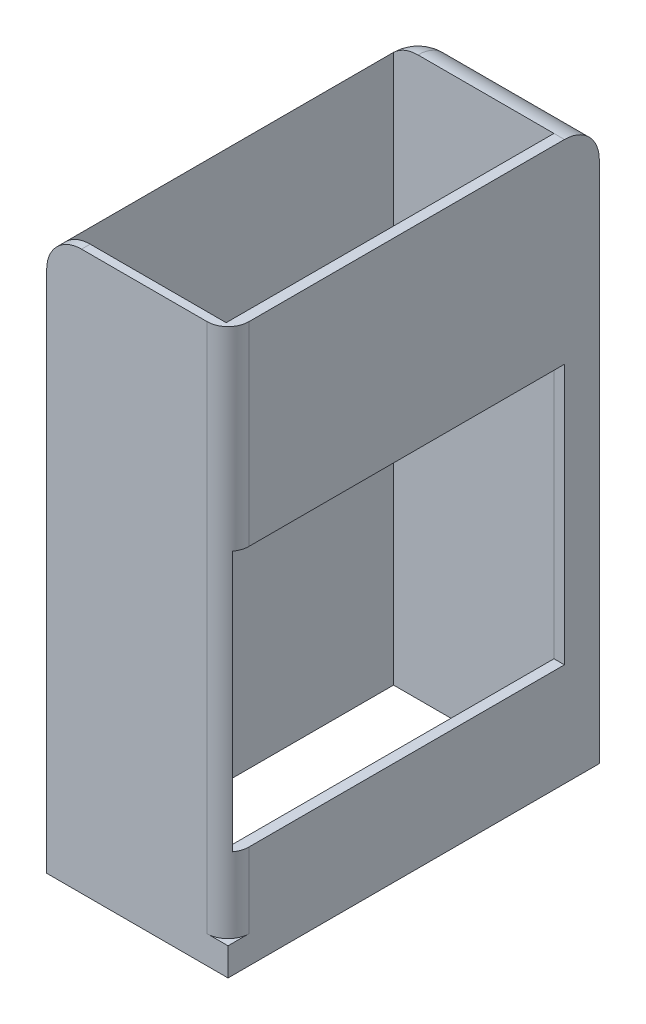
from build123d import *

# Parameters (mm, degrees)
BOSS_EXTRUDE1_DEPTH = 4
BOSS_EXTRUDE2_DEPTH = 80
SKETCH3_R           = 8.5
CUT_EXTRUDE1_DEPTH  = 171
SKETCH4_W           = 68
SKETCH4_H           = 18.002499925
CUT_EXTRUDE2_DEPTH  = 116
SKETCH5_W           = 23
SKETCH5_H           = 47
CUT_EXTRUDE3_DEPTH  = 110.266506281
SKETCH8_W           = 47
SKETCH8_H           = 37.321718457
CUT_EXTRUDE6_DEPTH  = 3.266506281
FILLET2_R           = 5
FILLET3_R           = 5
FILLET4_R           = 5
SKETCH9_W           = 106
SKETCH9_H           = 50.845410363
CUT_EXTRUDE7_DEPTH  = 92
FILLET16_R          = 10
FILLET18_R          = 3
CUT_EXTRUDE9_DEPTH  = 90


with BuildPart() as part:
    # Sketch1 → Boss-Extrude1 (new body)
    with BuildSketch(Plane(origin=(0, 0, 0), x_dir=(1, 0, 0), z_dir=(0, 1, 0))):
        Polygon((0, 152), (0, 101.37), (75, 101.37), (75, 191.351980657), (75, 192.37), (0, 192.37), align=None)
    extrude(amount=BOSS_EXTRUDE1_DEPTH)

    # Sketch2 → Boss-Extrude2 (add)
    with BuildSketch(Plane(origin=(0, 0, 0), x_dir=(-1, 0, 0), z_dir=(0, -1, 0))):
        Polygon((26, 91.37), (26, 176.99818396), (26, 195.45), (-80, 195.45), (-80, 176.99818396), (-80, 91.37), align=None)
        Polygon((-75, 192), (-75, 192.37), (0, 192.37), (0, 101.37), (-75, 101.37), align=None, mode=Mode.SUBTRACT)
    extrude(amount=-BOSS_EXTRUDE2_DEPTH)

    # Sketch3 → Cut-Extrude1 (cut)
    with BuildSketch(Plane.XY.offset(18)):
        with Locations((34.765402097, 21.5)):
            Circle(SKETCH3_R)
    extrude(amount=-CUT_EXTRUDE1_DEPTH, mode=Mode.SUBTRACT)

    # Sketch4 → Cut-Extrude2 (cut)
    with BuildSketch(Plane(origin=(0, 4, 0), x_dir=(1, 0, 0), z_dir=(0, 1, 0))):
        with Locations((34.5, 183.368750038)):
            Rectangle(SKETCH4_W, SKETCH4_H)
    extrude(amount=-CUT_EXTRUDE2_DEPTH, mode=Mode.SUBTRACT)

    # Sketch5 → Cut-Extrude3 (cut)
    with BuildSketch(Plane(origin=(0, 80, 0), x_dir=(1, 0, 0), z_dir=(0, 1, 0))):
        with Locations((-13, 166.95)):
            Rectangle(SKETCH5_W, SKETCH5_H)
    extrude(amount=-CUT_EXTRUDE3_DEPTH, mode=Mode.SUBTRACT)

    # Sketch8 → Cut-Extrude6 (cut)
    with BuildSketch(Plane.ZY.offset(1.5)):
        with Locations((-166.95181604, 33.429515658)):
            Rectangle(SKETCH8_W, SKETCH8_H)
    extrude(amount=-CUT_EXTRUDE6_DEPTH, mode=Mode.SUBTRACT)

    # Fillet2
    # the kernel refuses this fillet: 5 mm, written as the material it takes off along each edge
    with BuildSketch(Plane(origin=(-21, 75, -190.45), x_dir=(0, 0, -1), z_dir=(0, 1, 0))) as fillet2_piece_1_section:
        Polygon((0, 0), (FILLET2_R, 0), (FILLET2_R, FILLET2_R), (0, FILLET2_R), align=None)
    fillet2_piece_1 = extrude(amount=FILLET2_R, mode=Mode.PRIVATE)
    fillet2_piece_1 = fillet2_piece_1 - Plane(origin=(-21, 75, -190.45), x_dir=(0.7071067811865475, 0, 0.7071067811865475), z_dir=(0, 1, 0)) * Sphere(FILLET2_R, mode=Mode.PRIVATE)
    add(fillet2_piece_1, mode=Mode.SUBTRACT)
    with BuildSketch(Plane(origin=(80, -12.5, -91.37), x_dir=(-1, 0, 0), z_dir=(0, 1, 0))) as fillet2_piece_2:
        with BuildLine():
            CenterArc((FILLET2_R, -FILLET2_R), FILLET2_R, 90, 90)
            Line((0, -FILLET2_R), (0, 0))
            Line((0, 0), (FILLET2_R, 0))
        make_face()
    extrude(amount=105, mode=Mode.SUBTRACT)
    with BuildSketch(Plane(origin=(92.5, 80, -91.37), x_dir=(0, 0, -1), z_dir=(-1, 0, 0))) as fillet2_piece_3:
        with BuildLine():
            CenterArc((FILLET2_R, FILLET2_R), FILLET2_R, 180, 90)
            Line((0, FILLET2_R), (0, 0))
            Line((0, 0), (FILLET2_R, 0))
        make_face()
    extrude(amount=131, mode=Mode.SUBTRACT)
    with BuildSketch(Plane(origin=(-26, -12.5, -195.45), x_dir=(0, 0, 1), z_dir=(0, 1, 0))) as fillet2_piece_4:
        with BuildLine():
            CenterArc((FILLET2_R, FILLET2_R), FILLET2_R, 180, 90)
            Line((0, FILLET2_R), (0, 0))
            Line((0, 0), (FILLET2_R, 0))
        make_face()
    extrude(amount=87.5, mode=Mode.SUBTRACT)
    with BuildSketch(Plane(origin=(-26, 80, -78.87), x_dir=(1, 0, 0), z_dir=(0, 0, -1))) as fillet2_piece_5:
        with BuildLine():
            CenterArc((FILLET2_R, FILLET2_R), FILLET2_R, 180, 90)
            Line((0, FILLET2_R), (0, 0))
            Line((0, 0), (FILLET2_R, 0))
        make_face()
    extrude(amount=111.58, mode=Mode.SUBTRACT)
    with BuildSketch(Plane(origin=(80, -12.5, -195.45), x_dir=(-1, 0, 0), z_dir=(0, 1, 0))) as fillet2_piece_6:
        with BuildLine():
            CenterArc((FILLET2_R, FILLET2_R), FILLET2_R, 180, 90)
            Line((0, FILLET2_R), (0, 0))
            Line((0, 0), (FILLET2_R, 0))
        make_face()
    extrude(amount=105, mode=Mode.SUBTRACT)
    with BuildSketch(Plane(origin=(-21, 80, -195.45), x_dir=(0, 0, 1), z_dir=(1, 0, 0))) as fillet2_piece_7:
        with BuildLine():
            CenterArc((FILLET2_R, FILLET2_R), FILLET2_R, 180, 90)
            Line((0, FILLET2_R), (0, 0))
            Line((0, 0), (FILLET2_R, 0))
        make_face()
    extrude(amount=113.5, mode=Mode.SUBTRACT)

    # Fillet3
    # the kernel refuses this fillet: 5 mm, written as the material it takes off along each edge
    with BuildSketch(Plane(origin=(-21, 75, -96.37), x_dir=(0, 0, 1), z_dir=(-1, 0, 0))) as fillet3_piece_1_section:
        Polygon((0, 0), (FILLET3_R, 0), (FILLET3_R, FILLET3_R), (0, FILLET3_R), align=None)
    fillet3_piece_1 = extrude(amount=FILLET3_R, mode=Mode.PRIVATE)
    fillet3_piece_1 = fillet3_piece_1 - Plane(origin=(-21, 75, -96.37), x_dir=(0, -0.7071067811865475, -0.7071067811865475), z_dir=(-1, 0, 0)) * Sphere(FILLET3_R, mode=Mode.PRIVATE)
    add(fillet3_piece_1, mode=Mode.SUBTRACT)
    with BuildSketch(Plane(origin=(-26, -12.5, -91.37), x_dir=(0, 0, -1), z_dir=(0, 1, 0))) as fillet3_piece_2:
        with BuildLine():
            CenterArc((FILLET3_R, -FILLET3_R), FILLET3_R, 90, 90)
            Line((0, -FILLET3_R), (0, 0))
            Line((0, 0), (FILLET3_R, 0))
        make_face()
    extrude(amount=87.5, mode=Mode.SUBTRACT)

    # Fillet4
    # the kernel refuses this fillet: 5 mm, written as the material it takes off along each edge
    with BuildSketch(Plane(origin=(75, 75, -190.45), x_dir=(1, 0, 0), z_dir=(0, 1, 0))) as fillet4_piece_1_section:
        Polygon((0, 0), (FILLET4_R, 0), (FILLET4_R, FILLET4_R), (0, FILLET4_R), align=None)
    fillet4_piece_1 = extrude(amount=FILLET4_R, mode=Mode.PRIVATE)
    fillet4_piece_1 = fillet4_piece_1 - Plane(origin=(75, 75, -190.45), x_dir=(-0.7071067811865475, 0, 0.7071067811865475), z_dir=(0, 1, 0)) * Sphere(FILLET4_R, mode=Mode.PRIVATE)
    add(fillet4_piece_1, mode=Mode.SUBTRACT)
    with BuildSketch(Plane(origin=(75, 75, -96.37), x_dir=(1, 0, 0), z_dir=(0, 1, 0))) as fillet4_piece_2_section:
        Polygon((0, 0), (FILLET4_R, 0), (FILLET4_R, -FILLET4_R), (0, -FILLET4_R), align=None)
    fillet4_piece_2 = extrude(amount=FILLET4_R, mode=Mode.PRIVATE)
    fillet4_piece_2 = fillet4_piece_2 - Plane(origin=(75, 75, -96.37), x_dir=(-0.7071067811865475, 0, -0.7071067811865475), z_dir=(0, 1, 0)) * Sphere(FILLET4_R, mode=Mode.PRIVATE)
    add(fillet4_piece_2, mode=Mode.SUBTRACT)
    with BuildSketch(Plane(origin=(80, 80, -190.45), x_dir=(-1, 0, 0), z_dir=(0, 0, 1))) as fillet4_piece_3:
        with BuildLine():
            CenterArc((FILLET4_R, FILLET4_R), FILLET4_R, 180, 90)
            Line((0, FILLET4_R), (0, 0))
            Line((0, 0), (FILLET4_R, 0))
        make_face()
    extrude(amount=94.08, mode=Mode.SUBTRACT)

    # Sketch9 → Cut-Extrude7 (cut)
    with BuildSketch(Plane(origin=(0, 80, 0), x_dir=(1, 0, 0), z_dir=(0, 1, 0))):
        with Locations((27, 116.792705182)):
            Rectangle(SKETCH9_W, SKETCH9_H)
    extrude(amount=-CUT_EXTRUDE7_DEPTH, mode=Mode.SUBTRACT)

    # Fillet16
    # the kernel refuses this fillet: 10 mm, written as the material it takes off along each edge
    with BuildSketch(Plane(origin=(75, 101.650635095, -142.215410363), x_dir=(0, 0, -1), z_dir=(0, -1, 0))) as fillet16_piece_1:
        with BuildLine():
            CenterArc((8.660254038, 10), FILLET16_R, 210, 60)
            Line((0, 5), (0, 0))
            Line((0, 0), (8.660254038, 0))
        make_face()
    extrude(amount=97.650635095, mode=Mode.SUBTRACT)

    # Fillet18
    # the kernel refuses this fillet: 3 mm, written as the material it takes off along each edge
    with BuildSketch(Plane(origin=(0, 4, -142.215410363), x_dir=(-1, 0, 0), z_dir=(0, 1, 0))) as fillet18_piece_1:
        with BuildLine():
            CenterArc((FILLET18_R, -FILLET18_R), FILLET18_R, 90, 90)
            Line((0, -FILLET18_R), (0, 0))
            Line((0, 0), (FILLET18_R, 0))
        make_face()
    extrude(amount=83.5, mode=Mode.SUBTRACT)

    # Sketch10 → Cut-Extrude9 (cut)
    with BuildSketch(Plane.XZ):
        Polygon((80, -190.45), (80, -142.215410363), (0, -142.215410363), (0, -195.45), (80, -195.45), align=None)
    extrude(amount=-CUT_EXTRUDE9_DEPTH, mode=Mode.SUBTRACT)


solid = part.part
